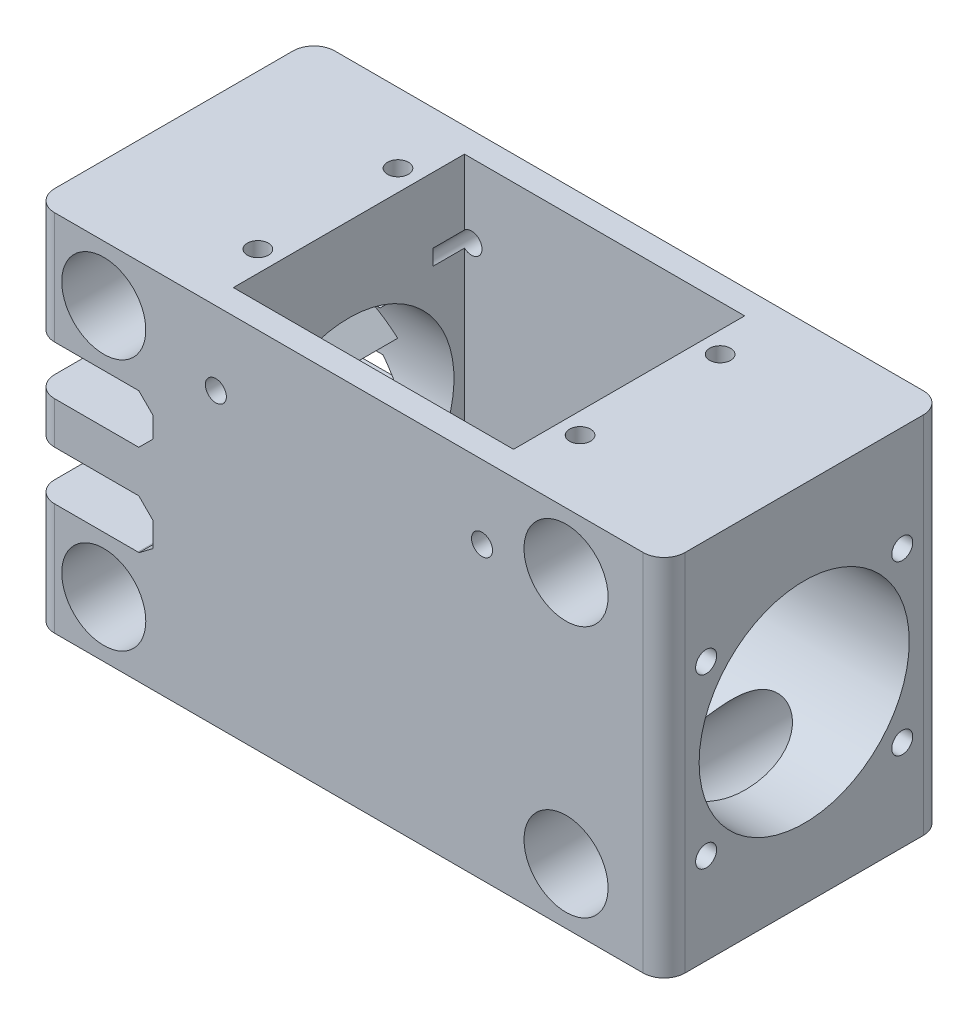
from build123d import *
from OCP.BRepFilletAPI import BRepFilletAPI_MakeChamfer

# Parameters (mm, degrees)
SKETCH_1_W           = 90
SKETCH_1_H           = 52
EXTRUDE_1_DEPTH      = 40
SKETCH_2_R           = 6
CUT_EXTRUDE_1_DEPTH  = 66.582009728
SKETCH_6_R           = 1.5
CUT_EXTRUDE_4_DEPTH  = 8
SKETCH_8_W           = 17
SKETCH_8_H           = 20
CUT_EXTRUDE_5_DEPTH  = 66.582009728
SKETCH_9_R           = 15
CUT_EXTRUDE_6_DEPTH  = 102.862652626
SKETCH_10_R          = 1.5
CUT_EXTRUDE_7_DEPTH  = 7
EXTRUDE_START        = -22
EXTRUDE_4_DEPTH      = 22
SKETCH_14_R          = 6
CUT_EXTRUDE_8_DEPTH  = 66.582009858
CUT_EXTRUDE_9_REACH  = 81.555
SKETCH_17_W          = 40
SKETCH_17_H          = 33
CHAMFER_9_SIZE       = 1
CHAMFER_9_SIZE2      = 7.115369722
EXTRUDE_START_2      = -17
EXTRUDE_6_DEPTH      = 17
CHAMFER_10_SIZE      = 4.100607683
CHAMFER_10_SIZE_2    = 2
SKETCH_20_R          = 6
CUT_EXTRUDE_13_DEPTH = 66.582009858
EXTRUDE_7_REACH      = 67.582
SKETCH_21_W          = 17
SKETCH_21_H          = 6
FILLET_3_R           = 3
CHAMFER_12_SIZE      = 3
CUT_EXTRUDE_START    = -8
SKETCH_24_R          = 1.5
CUT_EXTRUDE_16_DEPTH = 8
SKETCH_25_R          = 1.5
CUT_EXTRUDE_17_DEPTH = 10
CHAMFER_13_SIZE      = 2
CHAMFER_13_SIZE2     = 1.77078723


with BuildPart() as part:
    # 草圖1 → 填料-伸長1 (new body)
    with BuildSketch(Plane.XY):
        Rectangle(SKETCH_1_W, SKETCH_1_H)
    extrude(amount=EXTRUDE_1_DEPTH)

    # 草圖2 → 除料-伸長1 (cut, through all)
    with BuildSketch(Plane(origin=(0, 0, 0), x_dir=(-1, 0, 0), z_dir=(0, 0, -1))):
        with Locations((-31, -18)):
            Circle(SKETCH_2_R)
        with Locations(Location((35, -18, 0), (0, 0, 180))):
            Circle(SKETCH_2_R)
        with Locations((35, 18)):
            Circle(SKETCH_2_R)
        with Locations(Location((-31, 18, 0), (0, 0, 180))):
            Circle(SKETCH_2_R)
    extrude(amount=-CUT_EXTRUDE_1_DEPTH, mode=Mode.SUBTRACT)

    # 草圖6 → 除料-伸長4 (cut)
    with BuildSketch(Plane(origin=(0, 0, 0), x_dir=(-1, 0, 0), z_dir=(0, 0, -1))):
        with Locations((-19, 15.5)):
            Circle(SKETCH_6_R)
        with Locations((19, 15.5)):
            Circle(SKETCH_6_R)
    extrude(amount=-CUT_EXTRUDE_4_DEPTH, mode=Mode.SUBTRACT)

    # 草圖8 → 除料-伸長5 (cut, through all)
    with BuildSketch(Plane(origin=(0, 0, 0), x_dir=(-1, 0, 0), z_dir=(0, 0, -1))):
        with Locations((36.5, 0)):
            Rectangle(SKETCH_8_W, SKETCH_8_H)
    extrude(amount=-CUT_EXTRUDE_5_DEPTH, mode=Mode.SUBTRACT)

    # 草圖9 → 除料-伸長6 (cut, through all)
    with BuildSketch(Plane(origin=(45, 0, 0), x_dir=(0, 0, -1), z_dir=(1, 0, 0))):
        with Locations((-20, -1)):
            Circle(SKETCH_9_R)
    extrude(amount=-CUT_EXTRUDE_6_DEPTH, mode=Mode.SUBTRACT)

    # 草圖10 → 除料-伸長7 (cut)
    with BuildSketch(Plane(origin=(45, 0, 0), x_dir=(0, 0, -1), z_dir=(1, 0, 0))):
        with Locations((-34, 11)):
            Circle(SKETCH_10_R)
        with Locations(Location((-6, 11, 0), (0, 0, 180))):
            Circle(SKETCH_10_R)
        with Locations((-6, -13)):
            Circle(SKETCH_10_R)
        with Locations(Location((-34, -13, 0), (0, 0, 180))):
            Circle(SKETCH_10_R)
    extrude(amount=-CUT_EXTRUDE_7_DEPTH, mode=Mode.SUBTRACT)

    # 草圖11 → 填料-伸長4 (add)
    with BuildSketch(Plane.ZY.offset(45).offset(EXTRUDE_START)):
        with BuildLine():
            Line((8, -10), (32, -10))
            ThreePointArc((32, -10), (20, -16), (8, -10))
        make_face()
    extrude(amount=EXTRUDE_4_DEPTH)

    # 草圖14 → 除料-伸長8 (cut, through all)
    with BuildSketch(Plane(origin=(0, 0, 0), x_dir=(-1, 0, 0), z_dir=(0, 0, -1))):
        with Locations((-31, -18)):
            Circle(SKETCH_14_R)
        with Locations(Location((35, -18, 0), (0, 0, 180))):
            Circle(SKETCH_14_R)
    extrude(amount=-CUT_EXTRUDE_8_DEPTH, mode=Mode.SUBTRACT)

    # 草圖17 → 除料-伸長9 (cut, up to next)
    with BuildSketch(Plane.XZ.offset(26), mode=Mode.PRIVATE) as cut_extrude_9_sk1:
        with Locations((0, 20)):
            Rectangle(SKETCH_17_W, SKETCH_17_H)
    cut_extrude_9_tool1 = extrude(cut_extrude_9_sk1.sketch, amount=-CUT_EXTRUDE_9_REACH, mode=Mode.PRIVATE) & part.part
    add(cut_extrude_9_tool1.solids().sort_by_distance((0, -26, 20))[0], mode=Mode.SUBTRACT)

    # 導角9
    chamfer_9_edges = [part.edges().sort_by_distance(p)[0] for p in [
        (-23, -10, 20),
    ]]
    chamfer_9_side = [part.faces().sort_by_distance(p)[0] for p in [
        (-23, -12.44657889, 20),
    ]]
    chamfer(chamfer_9_edges, length=CHAMFER_9_SIZE, length2=CHAMFER_9_SIZE2, reference=chamfer_9_side[0])

    # 草圖19 → 填料-伸長6 (add)
    with BuildSketch(Plane.ZY.offset(45).offset(EXTRUDE_START_2)):
        with BuildLine():
            Line((9.801960973, 10), (30.198039027, 10))
            ThreePointArc((30.198039027, 10), (20, 14), (9.801960973, 10))
        make_face()
    extrude(amount=EXTRUDE_6_DEPTH)

    # 導角10
    # the kernel refuses this chamfer: 4.100607683, 2 mm, written as the material it takes off along each edge
    with BuildSketch(Plane(origin=(-28, 10, -0.81963963), x_dir=(0.016923890849829204, 0.9998567807033681, 0), z_dir=(0, 0, 1))) as chamfer_10_piece_1_section:
        Polygon((CHAMFER_10_SIZE * 0.999856780742, CHAMFER_10_SIZE * 0.0169238908505), (-CHAMFER_10_SIZE_2 * 0.0169238908498, CHAMFER_10_SIZE_2 * 0.999856780703), (0, 0), align=None)
    chamfer_10_piece_1 = extrude(amount=41.639279261, mode=Mode.PRIVATE)
    chamfer_10_piece_1 = chamfer_10_piece_1 & Plane(origin=(-28.71346755, -1, 20), x_dir=(0, 0, -1), z_dir=(1, 0, 0)) * Cylinder(15, 100, mode=Mode.PRIVATE)
    add(chamfer_10_piece_1, mode=Mode.SUBTRACT)

    # 草圖20 → 除料-伸長13 (cut, through all)
    with BuildSketch(Plane(origin=(0, 0, 0), x_dir=(-1, 0, 0), z_dir=(0, 0, -1))):
        with Locations((35, 18)):
            Circle(SKETCH_20_R)
    extrude(amount=-CUT_EXTRUDE_13_DEPTH, mode=Mode.SUBTRACT)

    # 填料-伸長7: up to this face of the body (flat: up to its plane)
    extrude_7_end = Plane(part.part.faces().sort_by_distance((3.440035567, -0.055755643, 0))[0])
    # 草圖21 → 填料-伸長7 (add, up to the picked face)
    with BuildSketch(Plane.XY.offset(40), mode=Mode.PRIVATE) as extrude_7_sk1:
        with Locations((-36.5, 0)):
            Rectangle(SKETCH_21_W, SKETCH_21_H)
    extrude_7_tool1 = split(extrude(extrude_7_sk1.sketch, amount=-EXTRUDE_7_REACH, mode=Mode.PRIVATE), bisect_by=extrude_7_end, keep=Keep.BOTH, mode=Mode.PRIVATE)
    add(extrude_7_tool1.solids().sort_by(Axis((-36.5, 0, 40), (0, 0, -1)))[0])

    # 圓角3
    fillet_3_edges = [part.edges().sort_by_distance(p)[0] for p in [
        (45, 0, 40),
        (-45, 0, 40),
        (-45, 0, 0),
        (-45, 18, 40),
        (-45, -18, 0),
        (-45, -18, 40),
        (45, 0, 0),
        (-45, 18, 0),
    ]]
    fillet(fillet_3_edges, radius=FILLET_3_R)

    # 導角12
    # the kernel refuses this chamfer: 3 mm, written as the material it takes off along each edge
    with BuildSketch(Plane(origin=(-28, -3, 42.581117711), x_dir=(-0.9996219169112968, -0.02749587661058648, 0), z_dir=(0, 0, -1))) as chamfer_12_piece_1_section:
        Polygon((CHAMFER_12_SIZE * 0.999621916911, CHAMFER_12_SIZE * 0.0274958766106), (-CHAMFER_12_SIZE * 0.0274958766106, CHAMFER_12_SIZE * 0.999621916911), (0, 0), align=None)
    chamfer_12_piece_1 = extrude(amount=45.162235422, mode=Mode.PRIVATE)
    chamfer_12_piece_1 = chamfer_12_piece_1 & Plane(origin=(-28.99910485, -1, 20), x_dir=(0, 0, -1), z_dir=(1, 0, 0)) * Cylinder(15, 103, mode=Mode.PRIVATE)
    add(chamfer_12_piece_1, mode=Mode.SUBTRACT)
    with BuildSketch(Plane(origin=(-28, 3, 42.171881259), x_dir=(-0.9996219169112968, 0.02749587661058619, 0), z_dir=(0, 0, -1))) as chamfer_12_piece_2_section:
        Polygon((CHAMFER_12_SIZE * 0.999621916911, -CHAMFER_12_SIZE * 0.0274958766106), (-CHAMFER_12_SIZE * 0.0274958766106, -CHAMFER_12_SIZE * 0.999621916911), (0, 0), align=None)
    chamfer_12_piece_2 = extrude(amount=44.343762517, mode=Mode.PRIVATE)
    chamfer_12_piece_2 = chamfer_12_piece_2 & Plane(origin=(-28.996755862, -1, 20), x_dir=(0, 0, -1), z_dir=(1, 0, 0)) * Cylinder(15, 101, mode=Mode.PRIVATE)
    add(chamfer_12_piece_2, mode=Mode.SUBTRACT)

    # 草圖24 → 除料-伸長16 (cut)
    with BuildSketch(Plane.XY.offset(40).offset(CUT_EXTRUDE_START)):
        with Locations(Location((-19, 15.5, 0), (0, 0, 180))):
            Circle(SKETCH_24_R)
        with Locations(Location((19, 15.5, 0), (0, 0, 180))):
            Circle(SKETCH_24_R)
    extrude(amount=CUT_EXTRUDE_16_DEPTH, mode=Mode.SUBTRACT)

    # 草圖25 → 除料-伸長17 (cut)
    with BuildSketch(Plane(origin=(0, 26, 0), x_dir=(1, 0, 0), z_dir=(0, 1, 0))):
        with Locations(Location((23, -10, 0), (0, 0, 270))):
            Circle(SKETCH_25_R)
        with Locations(Location((23, -30, 0), (0, 0, 90))):
            Circle(SKETCH_25_R)
        with Locations(Location((-23, -30, 0), (0, 0, 270))):
            Circle(SKETCH_25_R)
        with Locations(Location((-23, -10, 0), (0, 0, 90))):
            Circle(SKETCH_25_R)
    extrude(amount=-CUT_EXTRUDE_17_DEPTH, mode=Mode.SUBTRACT)

    # 導角13: one chamfer whose edges measure the first distance from different faces: ONE call of the kernel's chamfer builder (chamfer() names one face for all edges)
    chamfer_13_edges_1 = [part.edges().sort_by_distance(p)[0] for p in [
        (-28, -10.297295826, 4.114418246),
        (-28, -10.297295826, 35.885581754),
    ]]
    chamfer_13_side_1 = [part.faces().sort_by_distance(p)[0] for p in [
        (-27.02177909, -10.43477581, 20),
    ]]
    chamfer_13_edges_2 = [part.edges().sort_by_distance(p)[0] for p in [
        (-28, -3, 37.433034374),
        (-28, -3, 2.566965626),
        (-28, 10, 4.900980486),
        (-28, 10, 35.099019514),
        (-28, 3, 37.228416147),
        (-28, 3, 2.771583853),
    ]]
    chamfer_13 = BRepFilletAPI_MakeChamfer(part.part.solid().wrapped)
    for e in chamfer_13_edges_1:
        chamfer_13.Add(CHAMFER_13_SIZE, CHAMFER_13_SIZE2, e.wrapped, chamfer_13_side_1[0].wrapped)  # the first distance lies on this face
    for e in chamfer_13_edges_2:
        chamfer_13.Add(CHAMFER_13_SIZE, e.wrapped)
    add(Compound.cast(chamfer_13.Shape()), mode=Mode.REPLACE)


solid = part.part
